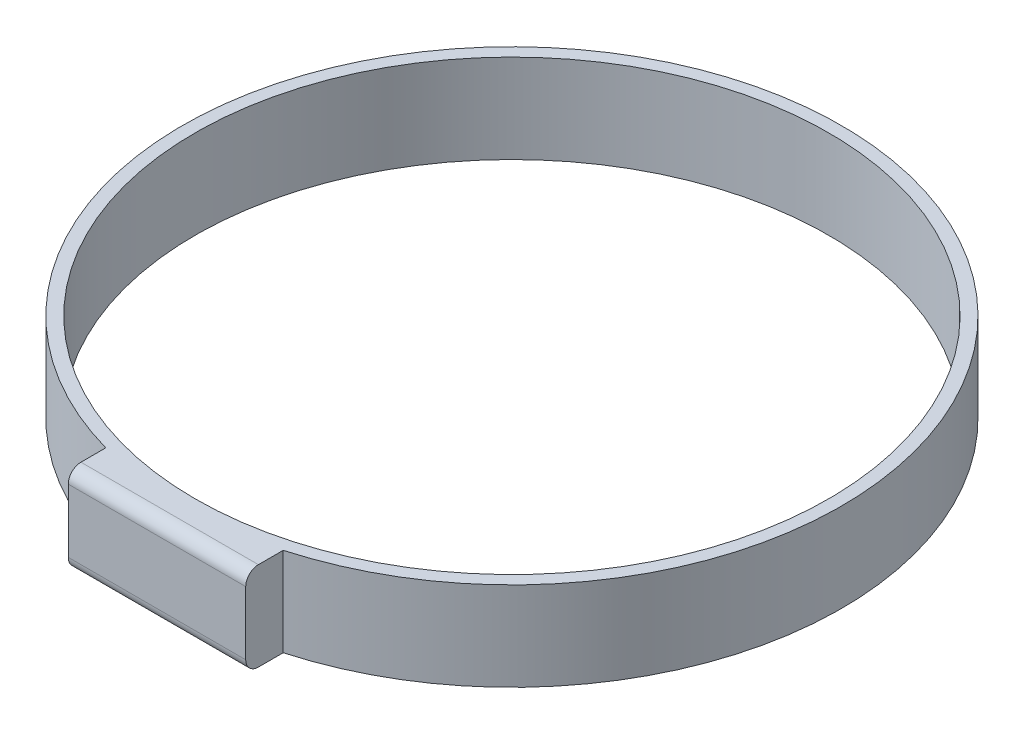
from build123d import *

# Parameters (mm, degrees)
SKETCH1_R           = 26
SKETCH1_R_2         = 25
BOSS_EXTRUDE1_DEPTH = 7
SKETCH2_W           = 14
SKETCH2_H           = 7
BOSS_EXTRUDE2_DEPTH = 3
FILLET1_R           = 1


with BuildPart() as part:
    # Sketch1 → Boss-Extrude1 (new body)
    with BuildSketch(Plane(origin=(0, 0, 0), x_dir=(1, 0, 0), z_dir=(0, 1, 0))):
        Circle(SKETCH1_R)
        Circle(SKETCH1_R_2, mode=Mode.SUBTRACT)
    extrude(amount=BOSS_EXTRUDE1_DEPTH)

    # Sketch2 → Boss-Extrude2 (add)
    with BuildSketch(Plane.XY.offset(25)):
        with Locations((0, 3.5)):
            Rectangle(SKETCH2_W, SKETCH2_H)
    extrude(amount=BOSS_EXTRUDE2_DEPTH)

    # Fillet1
    fillet1_edges = [part.edges().sort_by_distance(p)[0] for p in [
        (0, 0, 28),
        (0, 7, 28),
    ]]
    fillet(fillet1_edges, radius=FILLET1_R)


solid = part.part
